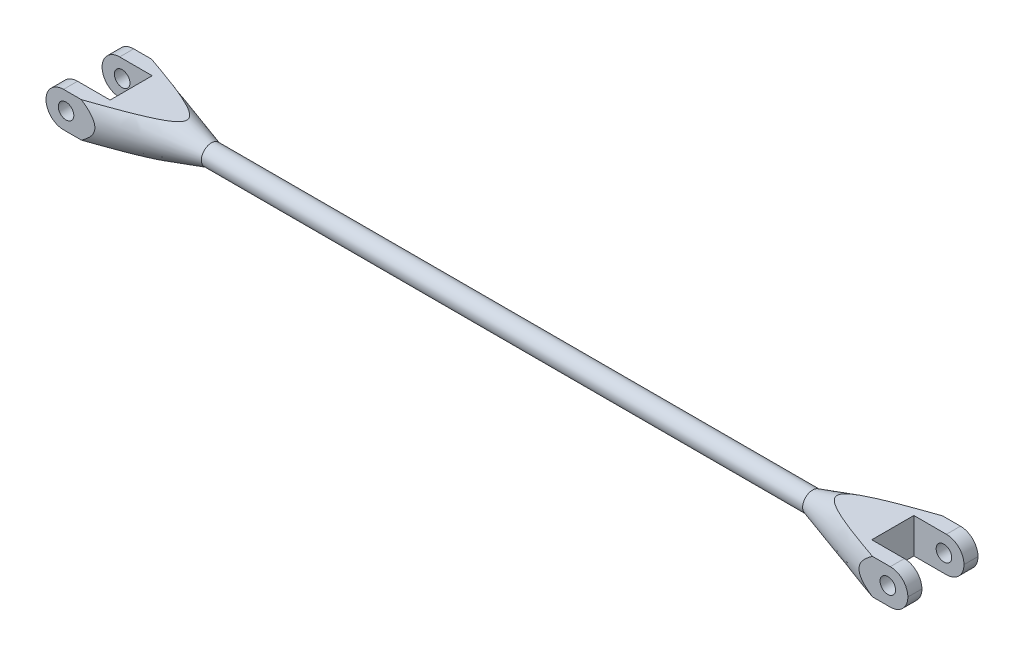
from build123d import *

# Parameters (mm, degrees)
SKETCH1_R            = 2
BOSS_EXTRUDE1_DEPTH  = 60
SKETCH3_R            = 10
SKETCH3_W            = 14
SKETCH3_H            = 7
CUT_EXTRUDE1_DEPTH   = 121.830459736
SKETCH4_W            = 10
SKETCH4_H            = 8.4
CUT_EXTRUDE2_DEPTH   = 87.567892431
SKETCH5_R            = 1.55
CUT_EXTRUDE3_DEPTH   = 88.202350886
FILLET1_R            = 3.5
FILLET1_OF_MIRROR1_R = 3.5


with BuildPart() as part:
    # Sketch1 → Boss-Extrude1 (new, symmetric)
    with BuildSketch(Plane(origin=(0, 0, 0), x_dir=(0, 0, -1), z_dir=(1, 0, 0))):
        Circle(SKETCH1_R)
    extrude(amount=BOSS_EXTRUDE1_DEPTH, both=True)

    # Sketch2 → Revolve2 (revolve)
    with BuildSketch(Plane(origin=(0, 0, 0), x_dir=(1, 0, 0), z_dir=(0, 1, 0)), mode=Mode.PRIVATE) as revolve2_sk:
        Polygon((60, -2), (86, -10), (86, 0), (60, 0), align=None)
    revolve2 = revolve(revolve2_sk.sketch.rotate(Axis((-1000, 0, 0), (1, 0, 0)), 180), axis=Axis((-1000, 0, 0), (1, 0, 0)))

    # Sketch3 → Cut-Extrude1 (cut, through all)
    with BuildSketch(Plane(origin=(60, 0, 0), x_dir=(0, 0, -1), z_dir=(1, 0, 0))):
        Circle(SKETCH3_R)
        Rectangle(SKETCH3_W, SKETCH3_H, mode=Mode.SUBTRACT)
    cut_extrude1 = extrude(amount=CUT_EXTRUDE1_DEPTH, mode=Mode.SUBTRACT)

    # Sketch4 → Cut-Extrude2 (cut, through all)
    with BuildSketch(Plane(origin=(0, 3.5, 0), x_dir=(1, 0, 0), z_dir=(0, 1, 0))):
        with Locations((81, 0)):
            Rectangle(SKETCH4_W, SKETCH4_H)
    cut_extrude2 = extrude(amount=-CUT_EXTRUDE2_DEPTH, mode=Mode.SUBTRACT)

    # Sketch5 → Cut-Extrude3 (cut, through all)
    with BuildSketch(Plane.XY.offset(7)):
        with Locations((82, 0)):
            Circle(SKETCH5_R)
    cut_extrude3 = extrude(amount=-CUT_EXTRUDE3_DEPTH, mode=Mode.SUBTRACT)

    # Fillet1
    fillet1_edges = [part.edges().sort_by_distance(p)[0] for p in [
        (86, -3.5, -5.6),
        (86, 3.5, -5.6),
        (86, -3.5, 5.6),
        (86, 3.5, 5.6),
    ]]
    fillet(fillet1_edges, radius=FILLET1_R - 0.0001)  # a hair under: the kernel refuses the full size

    # Mirror1: Revolve2, Cut-Extrude1, Cut-Extrude2, Cut-Extrude3 across plane
    add(revolve2.mirror(Plane(origin=(0, 0, 0), x_dir=(0, 0, 1), z_dir=(1, 0, 0))))
    add(cut_extrude1.mirror(Plane(origin=(0, 0, 0), x_dir=(0, 0, 1), z_dir=(1, 0, 0))), mode=Mode.SUBTRACT)
    add(cut_extrude2.mirror(Plane(origin=(0, 0, 0), x_dir=(0, 0, 1), z_dir=(1, 0, 0))), mode=Mode.SUBTRACT)
    add(cut_extrude3.mirror(Plane(origin=(0, 0, 0), x_dir=(0, 0, 1), z_dir=(1, 0, 0))), mode=Mode.SUBTRACT)

    # Fillet1 of Mirror1
    fillet1_of_mirror1_edges = [part.edges().sort_by_distance(p)[0] for p in [
        (-86, -3.5, -5.6),
        (-86, 3.5, -5.6),
        (-86, -3.5, 5.6),
        (-86, 3.5, 5.6),
    ]]
    fillet(fillet1_of_mirror1_edges, radius=FILLET1_OF_MIRROR1_R - 0.0001)  # a hair under: the kernel refuses the full size


solid = part.part
